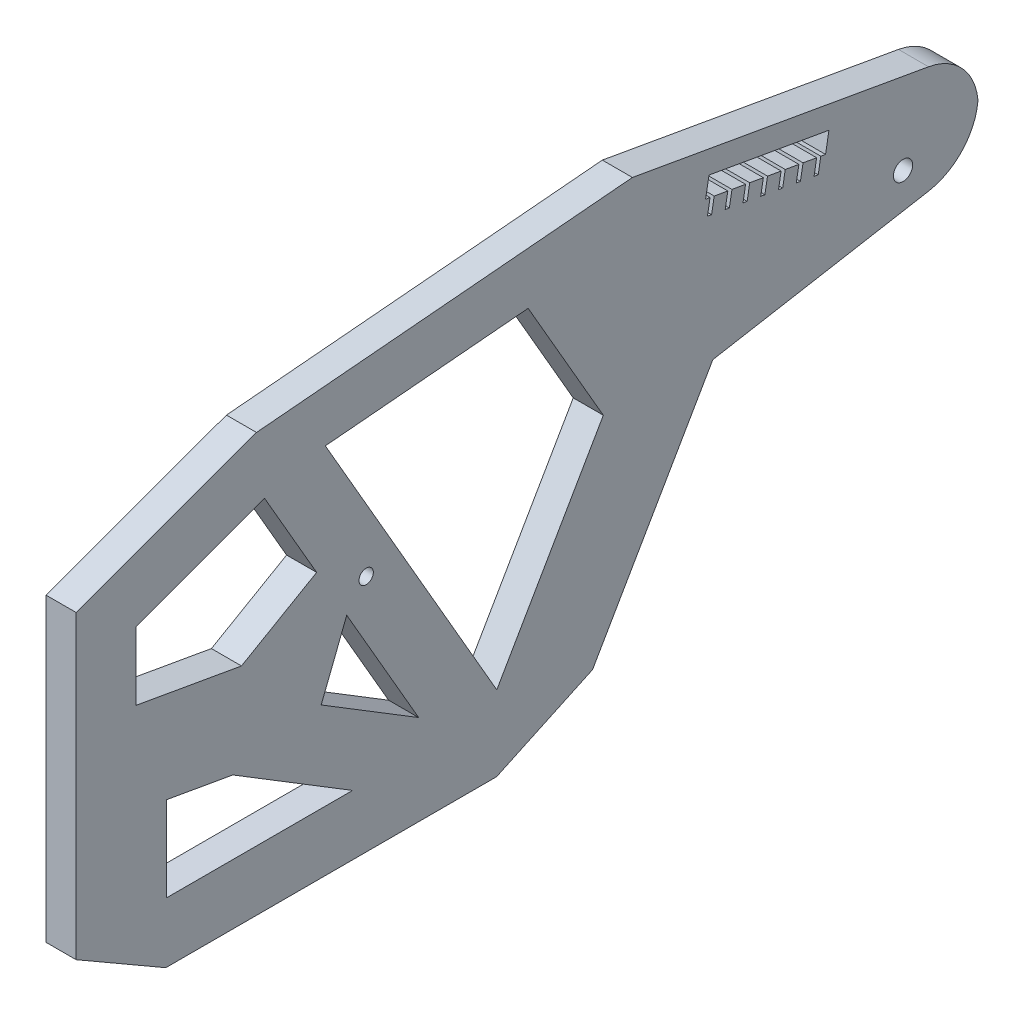
from build123d import *

# Parameters (mm, degrees)
ESQUISSE1_W                             = 300
ESQUISSE1_H                             = 150
BOSS_EXTRU_1_DEPTH                      = 5
ESQUISSE2_OUTSIDE_W                     = 369.112
ESQUISSE2_OUTSIDE_H                     = 219.112
ENL_V_MAT_EXTRU_1_DEPTH                 = 5
ENL_V_MAT_EXTRU_2_DEPTH                 = 336.559234711
ENL_V_MAT_EXTRU_2_DEPTH_BACK            = 336.559234711
ENL_V_MAT_EXTRU_4_DEPTH                 = 336.559234711
ENL_V_MAT_EXTRU_4_DEPTH_BACK            = 336.559234711
ESQUISSE5_R                             = 3.2
EMPREINTE1_START                        = -213.565883238
EMPREINTE1_OUTLINE_W                    = 10
EMPREINTE1_OUTLINE_H                    = 6
EMPREINTE1_DEPTH                        = 20
D_PLACER_START                          = -213.815883238
D_PLACER_LA_FACE1_OUTLINE_W             = 10
D_PLACER_LA_FACE1_OUTLINE_H             = 6.5
D_PLACER_LA_FACE1_DEPTH                 = 20.5
D_PLACER_LA_FACE2_BY                    = 10
D_PLACER_LA_FACE3_BY                    = 10
ENL_V_MAT_EXTRU_5_DEPTH                 = 336.559234711
R_P_TITION_LIN_AIRE1_COUNT              = 7
R_P_TITION_LIN_AIRE1_PITCH              = 6
CONG_1_R                                = 20
PER_AGE_POUR_CROUS_AUTO_BLOQUANTS_300_D = 4.7625


# Read off the part's stored shape, not the designer's step: Empreinte1, Déplacer la face1
with BuildPart() as part:
    # Esquisse1 → Boss.-Extru.1 (new, symmetric)
    with BuildSketch(Plane(origin=(0, 0, 0), x_dir=(0, 0, -1), z_dir=(1, 0, 0))):
        with Locations((150, 75)):
            Rectangle(ESQUISSE1_W, ESQUISSE1_H)
    extrude(amount=BOSS_EXTRU_1_DEPTH, both=True)

    # Esquisse2 outside → Enlèv. mat.-Extru.1 (cut, symmetric)
    with BuildSketch(Plane(origin=(0, 0, 0), x_dir=(0, 0, -1), z_dir=(1, 0, 0))):
        with Locations((150, 75)):
            Rectangle(ESQUISSE2_OUTSIDE_W, ESQUISSE2_OUTSIDE_H)
        Polygon((0, 117.225703003), (60, 139.063917059), (185, 150), (300, 129.722397219), (300, 99.722397219), (211.741963761, 84.160124165), (171.741963761, 14.878091862), (139.835792798, 0), (29.835792798, 0), (0, 17.225703003), align=None, mode=Mode.SUBTRACT)
    extrude(amount=ENL_V_MAT_EXTRU_1_DEPTH, both=True, mode=Mode.SUBTRACT)

    # Esquisse3 → Enlèv. mat.-Extru.2 (cut, two sides: drawn at the far end of the back side and taken through both)
    with BuildSketch(Plane(origin=(5, 0, 0), x_dir=(0, 0, -1), z_dir=(1, 0, 0)).offset(-ENL_V_MAT_EXTRU_2_DEPTH_BACK)):
        Polygon((20, 103.221552239), (20, 80.493304508), (55, 74.321860183), (80, 88.755616913), (62.679491924, 118.755616913), align=None)
        Polygon((90, 71.435108837), (113.922571241, 30), (81.508057782, 49.831775443), align=None)
        Polygon((82.886751346, 123.755616913), (139.903333355, 25), (175.32640016, 86.354551467), (150.32640016, 129.655821657), align=None)
        Polygon((91.944969354, 20), (30, 20), (30, 48.267236345), (52.117107943, 44.367393479), align=None)
    extrude(amount=ENL_V_MAT_EXTRU_2_DEPTH + ENL_V_MAT_EXTRU_2_DEPTH_BACK, mode=Mode.SUBTRACT)

    # Esquisse5 → Enlèv. mat.-Extru.4 (cut, two sides: drawn at the far end of the back side and taken through both)
    with BuildSketch(Plane.ZY.offset(5).offset(-ENL_V_MAT_EXTRU_4_DEPTH_BACK)):
        with Locations((-275, 107.010571736)):
            Circle(ESQUISSE5_R)
    extrude(amount=ENL_V_MAT_EXTRU_4_DEPTH + ENL_V_MAT_EXTRU_4_DEPTH_BACK, mode=Mode.SUBTRACT)

    # Empreinte1 outline → Empreinte1 (cut)
    with BuildSketch(Plane(origin=(0, 0, 0), x_dir=(1, 0, 0), z_dir=(0, 0.173648177666931, 0.984807753012208)).offset(EMPREINTE1_START)):
        with Locations((0, 169.157749671)):
            Rectangle(EMPREINTE1_OUTLINE_W, EMPREINTE1_OUTLINE_H)
    extrude(amount=EMPREINTE1_DEPTH, mode=Mode.SUBTRACT)

    # Déplacer la face1 outline → Déplacer la face1 (cut)
    with BuildSketch(Plane(origin=(0, 0, 0), x_dir=(1, 0, 0), z_dir=(0, 0.173648177666931, 0.984807753012208)).offset(D_PLACER_START)):
        with Locations((0, 169.157749671)):
            Rectangle(D_PLACER_LA_FACE1_OUTLINE_W, D_PLACER_LA_FACE1_OUTLINE_H)
    extrude(amount=D_PLACER_LA_FACE1_DEPTH, mode=Mode.SUBTRACT)

    # Déplacer la face2: a face moved inward by 10.0
    extrude(part.faces().sort_by_distance((0, 133.01891252, -219.752915562))[0], amount=D_PLACER_LA_FACE2_BY, dir=(0, 0.173648178, 0.984807753), mode=Mode.SUBTRACT)

    # Déplacer la face3: a face moved inward by 10.0
    extrude(part.faces().sort_by_distance((0, 129.459124878, -239.941474499))[0], amount=D_PLACER_LA_FACE3_BY, dir=(0, -0.173648178, -0.984807753), mode=Mode.SUBTRACT)

    # Esquisse6 → Enlèv. mat.-Extru.5 (cut, through all)
    with BuildSketch(Plane(origin=(5, 0, 0), x_dir=(0, 0, -1), z_dir=(1, 0, 0))):
        Polygon((210.817693083, 131.294296833), (209.949452195, 126.370258067), (211.328183049, 126.127150619), (212.196423938, 131.051189384), align=None)
    enl_v_mat_extru_5 = extrude(amount=-ENL_V_MAT_EXTRU_5_DEPTH, mode=Mode.SUBTRACT)

    # Répétition linéaire1: Enlèv. mat.-Extru.5 ×7
    with Locations(*[Vector(0, -0.17364817766693066, -0.9848077530122081) * (i * R_P_TITION_LIN_AIRE1_PITCH) for i in range(1, R_P_TITION_LIN_AIRE1_COUNT)]):
        add(enl_v_mat_extru_5, mode=Mode.SUBTRACT)

    # Congé1
    # the kernel refuses this fillet: 20 mm, written as the material it takes off along each edge
    with BuildSketch(Plane(origin=(-46.954981559, 129.722397219, -300), x_dir=(0, 0.17364817766693125, 0.9848077530122079), z_dir=(1, 0, 0))) as cong_1_piece_1:
        with BuildLine():
            CenterArc((CONG_1_R * 0.839099631177, CONG_1_R), CONG_1_R, 190, 80)
            Line((-CONG_1_R * 0.145708121835, CONG_1_R * 0.826351822333), (0, 0))
            Line((0, 0), (CONG_1_R * 0.839099631177, 0))
        make_face()
    extrude(amount=93.909963118, mode=Mode.SUBTRACT)
    with BuildSketch(Plane(origin=(-46.954981559, 99.722397219, -300), x_dir=(0, -0.17364817766692434, 0.984807753012209), z_dir=(1, 0, 0))) as cong_1_piece_2:
        with BuildLine():
            CenterArc((CONG_1_R * 0.839099631177, -CONG_1_R), CONG_1_R, 90, 80)
            Line((-CONG_1_R * 0.145708121835, -CONG_1_R * 0.826351822333), (0, 0))
            Line((0, 0), (CONG_1_R * 0.839099631177, 0))
        make_face()
    extrude(amount=93.909963118, mode=Mode.SUBTRACT)

    # Perçage pour écrous auto-bloquants 300® #6 (SP)1 (through all)
    with Locations(Plane(origin=(5, 0, 0), x_dir=(0, 0, -1), z_dir=(1, 0, 0))):
        with Locations((96.461753504, 79.36920384)):
            Hole(PER_AGE_POUR_CROUS_AUTO_BLOQUANTS_300_D / 2)


solid = part.part
